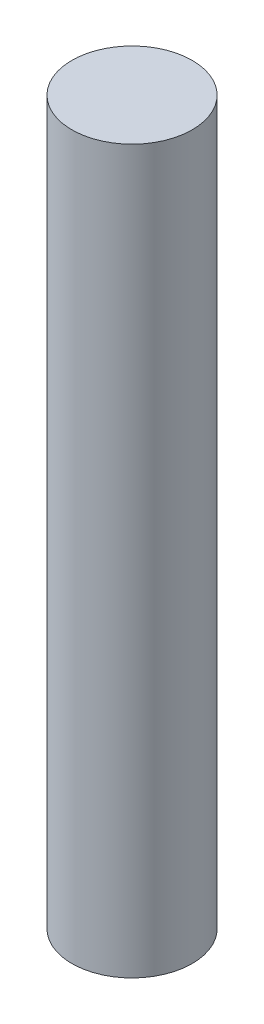
from build123d import *

# Parameters (mm, degrees)
SKETCH1_R           = 12.7
BOSS_EXTRUDE1_DEPTH = 152.4


with BuildPart() as part:
    # Sketch1 → Boss-Extrude1 (new body)
    with BuildSketch(Plane(origin=(0, 0, 0), x_dir=(1, 0, 0), z_dir=(0, 1, 0))):
        Circle(SKETCH1_R)
    extrude(amount=BOSS_EXTRUDE1_DEPTH)


solid = part.part
